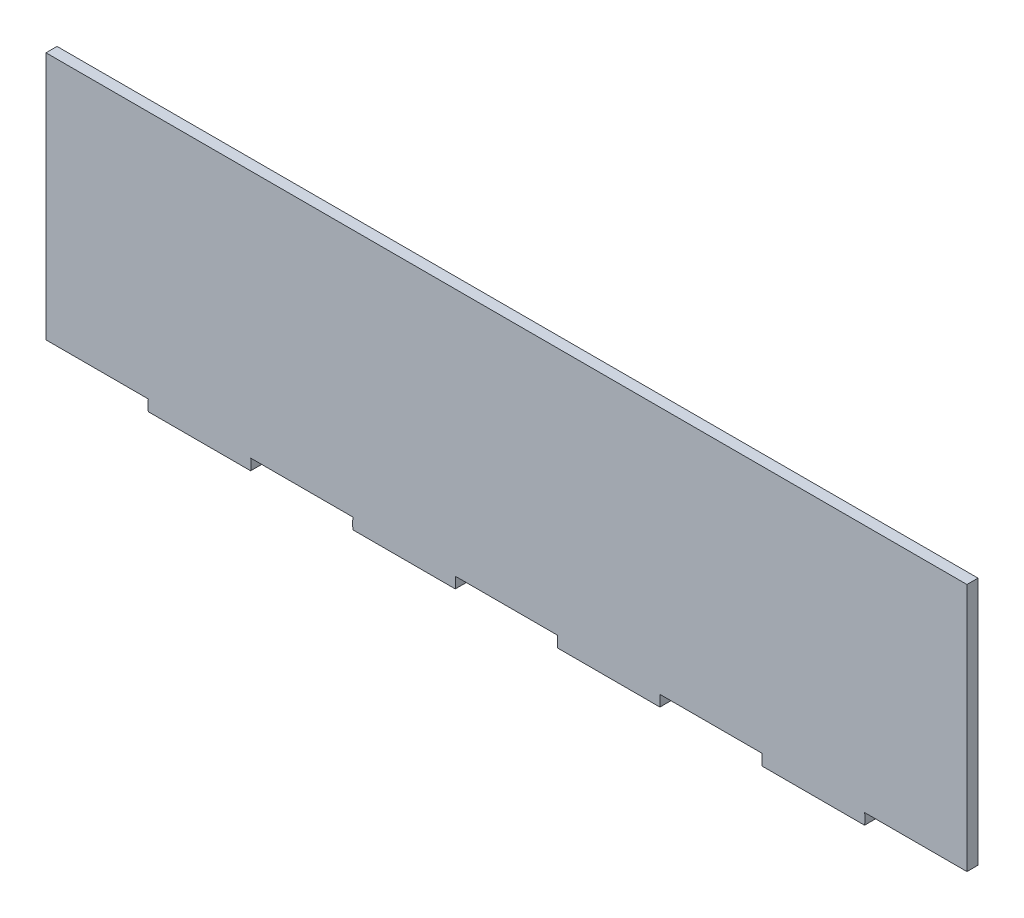
from build123d import *

# Parameters (mm, degrees)
SKETCH1_W           = 500
SKETCH1_H           = 141
BOSS_EXTRUDE1_DEPTH = 6
CUT_EXTRUDE1_DEPTH  = 6
LPATTERN1_COUNT     = 5
LPATTERN1_PITCH     = 111.1
SKETCH3_W           = 0.553654801
SKETCH3_H           = 6
CUT_EXTRUDE2_DEPTH  = 6
SKETCH4_W           = 0.612580516
SKETCH4_H           = 6
CUT_EXTRUDE3_DEPTH  = 6


with BuildPart() as part:
    # Sketch1 → Boss-Extrude1 (new body)
    with BuildSketch(Plane.XY):
        Rectangle(SKETCH1_W, SKETCH1_H)
    extrude(amount=BOSS_EXTRUDE1_DEPTH)

    # Sketch2 → Cut-Extrude1 (cut)
    with BuildSketch(Plane.XY.offset(6)):
        with BuildLine():
            add(Edge.make_bspline(
                [(194.4, -70.5), (194.6, -70.5), (194.6, -67.5), (194.6, -64.5), (194.4, -64.5)],
                knots=[3.141592654, 3.141592654, 3.141592654, 4.71238898, 4.71238898, 6.283185307, 6.283185307, 6.283185307], degree=2, weights=[1, 0.707106781, 1, 0.707106781, 1]))
            Line((194.4, -70.5), (250, -70.5))
            add(Edge.make_bspline(
                [(250, -64.5), (249.8, -64.5), (249.8, -67.5), (249.8, -70.5), (250, -70.5)],
                knots=[3.141592654, 3.141592654, 3.141592654, 4.71238898, 4.71238898, 6.283185307, 6.283185307, 6.283185307], degree=2, weights=[1, 0.707106781, 1, 0.707106781, 1]))
            Line((250, -64.5), (194.4, -64.5))
        make_face()
    cut_extrude1 = extrude(amount=-CUT_EXTRUDE1_DEPTH, mode=Mode.SUBTRACT)


with BuildPart() as cut_extrude1_piece_1:
    # of the separate pieces the step leaves, piece 1, a body of its own (cut_extrude1_pieces)
    add(part.part.solids().sort_by_distance((-250, -70.5, 0))[0])

    # LPattern1: Cut-Extrude1 ×5
    with Locations(*[(-i * LPATTERN1_PITCH, 0, 0) for i in range(1, LPATTERN1_COUNT)]):
        add(cut_extrude1, mode=Mode.SUBTRACT)

    # Sketch3 → Cut-Extrude2 (cut)
    with BuildSketch(Plane.XY.offset(6)):
        with Locations((-249.7231726, -67.5)):
            Rectangle(SKETCH3_W, SKETCH3_H)
    extrude(amount=-CUT_EXTRUDE2_DEPTH, mode=Mode.SUBTRACT)


with BuildPart() as cut_extrude1_piece_2:
    # of the separate pieces the step leaves, piece 2, a body of its own (cut_extrude1_pieces)
    add(part.part.solids().sort_by_distance((250, -70.5, 0))[0])

    # Sketch4 → Cut-Extrude3 (cut)
    with BuildSketch(Plane.XY.offset(6)):
        with Locations((249.693709742, -67.5)):
            Rectangle(SKETCH4_W, SKETCH4_H)
    extrude(amount=-CUT_EXTRUDE3_DEPTH, mode=Mode.SUBTRACT)


solid = cut_extrude1_piece_1.part
